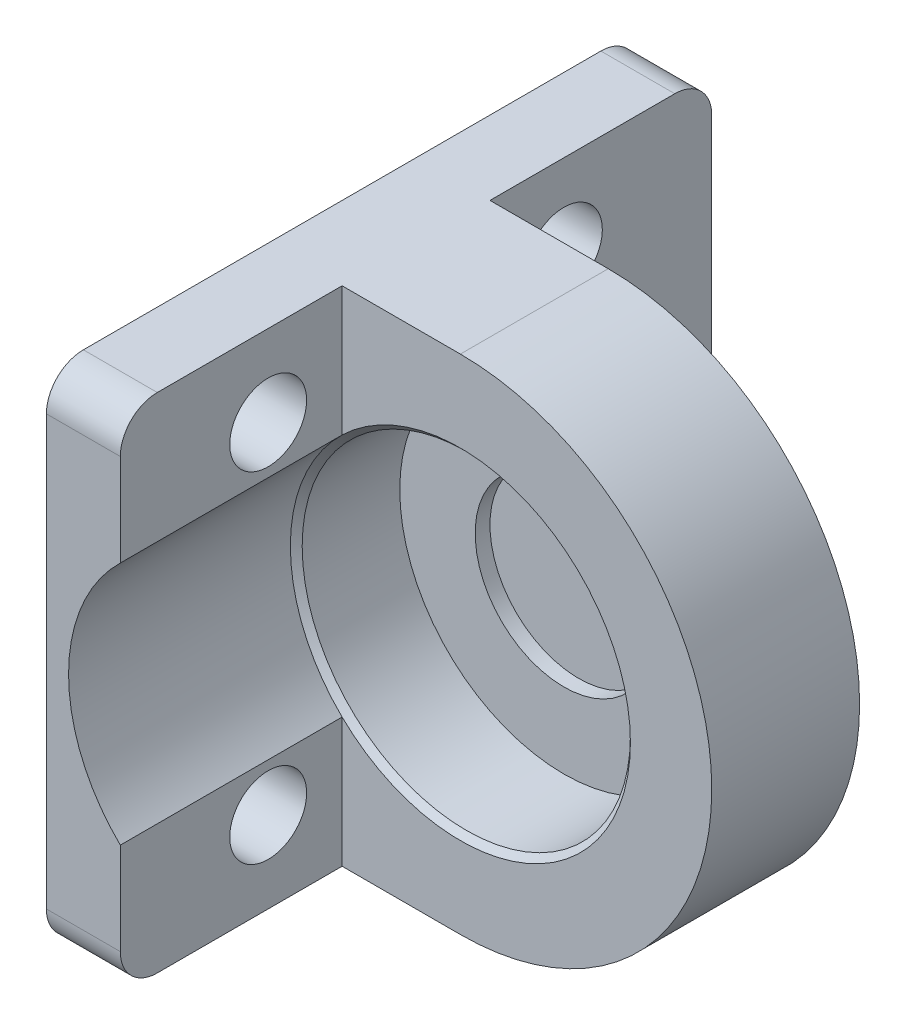
from build123d import *

# Parameters (mm, degrees)
EXTRUDE_1_DEPTH      = 10
SKETCH_10_W          = 40
SKETCH_10_H          = 34
EXTRUDE_3_DEPTH      = 5
SKETCH_11_R          = 2.6
CUT_EXTRUDE_7_DEPTH  = 40.230090492
SKETCH_2_R           = 11.1
CUT_EXTRUDE_1_DEPTH  = 7
SKETCH_3_R           = 6
CUT_EXTRUDE_2_DEPTH  = 1
SKETCH_14_R          = 11.5
CUT_EXTRUDE_10_DEPTH = 35.684290392
CHAMFER_1_SIZE       = 0.4
FILLET_1_R           = 2.5


with BuildPart() as part:
    # Эскиз1 → Бобышка-Вытянуть1 (new body)
    with BuildSketch(Plane.XY):
        with BuildLine():
            Line((0, 17), (-13, 17))
            Line((-13, 17), (-13, -17))
            Line((-13, -17), (0, -17))
            ThreePointArc((0, -17), (17, 0), (0, 17))
        make_face()
    extrude(amount=EXTRUDE_1_DEPTH)

    # Эскиз10 → Бобышка-Вытянуть3 (add)
    with BuildSketch(Plane.ZY.offset(13)):
        with Locations((5, 0)):
            Rectangle(SKETCH_10_W, SKETCH_10_H)
    extrude(amount=-EXTRUDE_3_DEPTH)

    # Эскиз11 → Вырез-Вытянуть7 (cut, through all)
    with BuildSketch(Plane(origin=(-8, 0, 0), x_dir=(0, 0, -1), z_dir=(1, 0, 0))):
        with Locations(Location((5, -11.5, 0), (0, 0, 90))):
            Circle(SKETCH_11_R)
        with Locations(Location((5, 11.5, 0), (0, 0, 90))):
            Circle(SKETCH_11_R)
        with Locations(Location((-15, 11.5, 0), (0, 0, 90))):
            Circle(SKETCH_11_R)
        with Locations(Location((-15, -11.5, 0), (0, 0, 90))):
            Circle(SKETCH_11_R)
    extrude(amount=-CUT_EXTRUDE_7_DEPTH, mode=Mode.SUBTRACT)

    # Эскиз2 → Вырез-Вытянуть1 (cut)
    with BuildSketch(Plane.XY.offset(10)):
        Circle(SKETCH_2_R)
    extrude(amount=-CUT_EXTRUDE_1_DEPTH, mode=Mode.SUBTRACT)

    # Эскиз3 → Вырез-Вытянуть2 (cut)
    with BuildSketch(Plane.XY.offset(3)):
        Circle(SKETCH_3_R)
    extrude(amount=-CUT_EXTRUDE_2_DEPTH, mode=Mode.SUBTRACT)

    # Эскиз14 → Вырез-Вытянуть10 (cut, through all)
    with BuildSketch(Plane.XY.offset(10)):
        Circle(SKETCH_14_R)
    extrude(amount=CUT_EXTRUDE_10_DEPTH, mode=Mode.SUBTRACT)

    # Фаска1
    chamfer_1_edges = [part.edges().sort_by_distance(p)[0] for p in [
        (-11.1, 0, 10),
    ]]
    chamfer(chamfer_1_edges, length=CHAMFER_1_SIZE - 0.0001)  # a hair under: the kernel refuses the full size

    # Скругление1
    fillet_1_edges = [part.edges().sort_by_distance(p)[0] for p in [
        (-10.5, 17, -15),
        (-10.5, 17, 25),
        (-10.5, -17, 25),
        (-10.5, -17, -15),
    ]]
    fillet(fillet_1_edges, radius=FILLET_1_R)


solid = part.part
